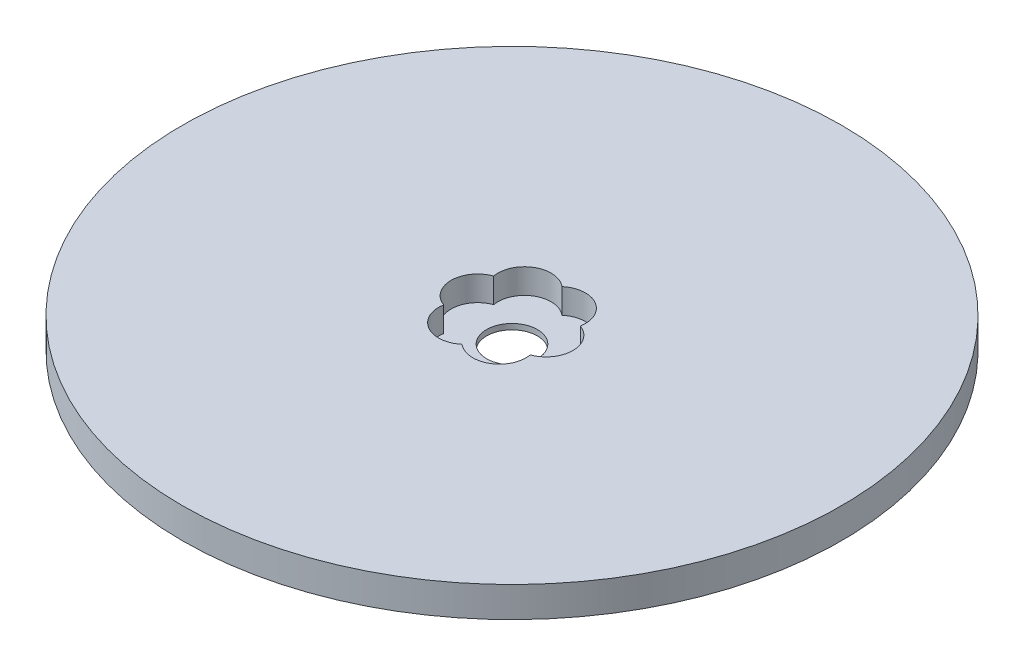
from build123d import *

# Parameters (mm, degrees)
SKETCH1_R           = 65
BOSS_EXTRUDE1_DEPTH = 6
SKETCH2_R           = 5
CUT_EXTRUDE1_DEPTH  = 93.119487623
SKETCH3_R           = 5.243686523
CUT_EXTRUDE2_DEPTH  = 4.90143592
CIRPATTERN1_COUNT   = 6


with BuildPart() as part:
    # Sketch1 → Boss-Extrude1 (new body)
    with BuildSketch(Plane(origin=(0, 0, 0), x_dir=(1, 0, 0), z_dir=(0, 1, 0))):
        Circle(SKETCH1_R)
    extrude(amount=BOSS_EXTRUDE1_DEPTH)

    # Sketch2 → Cut-Extrude1 (cut, through all)
    with BuildSketch(Plane(origin=(0, 0, 0), x_dir=(1, 0, 0), z_dir=(0, 1, 0))):
        Circle(SKETCH2_R)
    extrude(amount=CUT_EXTRUDE1_DEPTH, mode=Mode.SUBTRACT)

    # Sketch3 → Cut-Extrude2 (cut)
    with BuildSketch(Plane(origin=(0, 6, 0), x_dir=(1, 0, 0), z_dir=(0, 1, 0))):
        with Locations((-6.759613597, 0)):
            Circle(SKETCH3_R)
    cut_extrude2 = extrude(amount=-CUT_EXTRUDE2_DEPTH, mode=Mode.SUBTRACT)

    # CirPattern1: Cut-Extrude2 ×6 about axis
    cirpattern1_axis = Axis((0, 0, 0), (0, 1, 0))
    for i in range(1, CIRPATTERN1_COUNT):
        add(cut_extrude2.rotate(cirpattern1_axis, i * 360 / CIRPATTERN1_COUNT), mode=Mode.SUBTRACT)


solid = part.part
